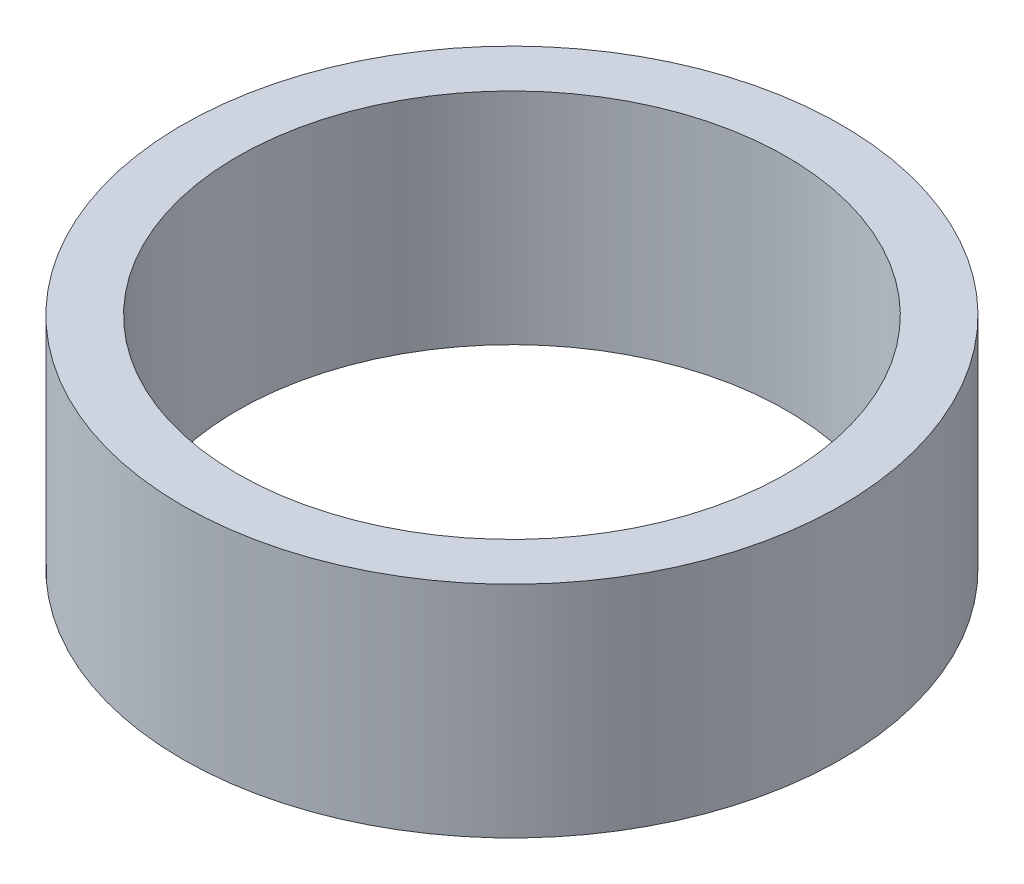
from build123d import *

# Parameters (mm, degrees)
SKETCH1_R           = 45
BOSS_EXTRUDE1_DEPTH = 30
SKETCH2_R           = 37.5
CUT_EXTRUDE1_DEPTH  = 71.356236397


with BuildPart() as part:
    # Sketch1 → Boss-Extrude1 (new body)
    with BuildSketch(Plane(origin=(0, 0, 0), x_dir=(1, 0, 0), z_dir=(0, 1, 0))):
        Circle(SKETCH1_R)
    extrude(amount=BOSS_EXTRUDE1_DEPTH)

    # Sketch2 → Cut-Extrude1 (cut, through all)
    with BuildSketch(Plane(origin=(0, 0, 0), x_dir=(1, 0, 0), z_dir=(0, 1, 0))):
        Circle(SKETCH2_R)
    extrude(amount=CUT_EXTRUDE1_DEPTH, mode=Mode.SUBTRACT)


solid = part.part
